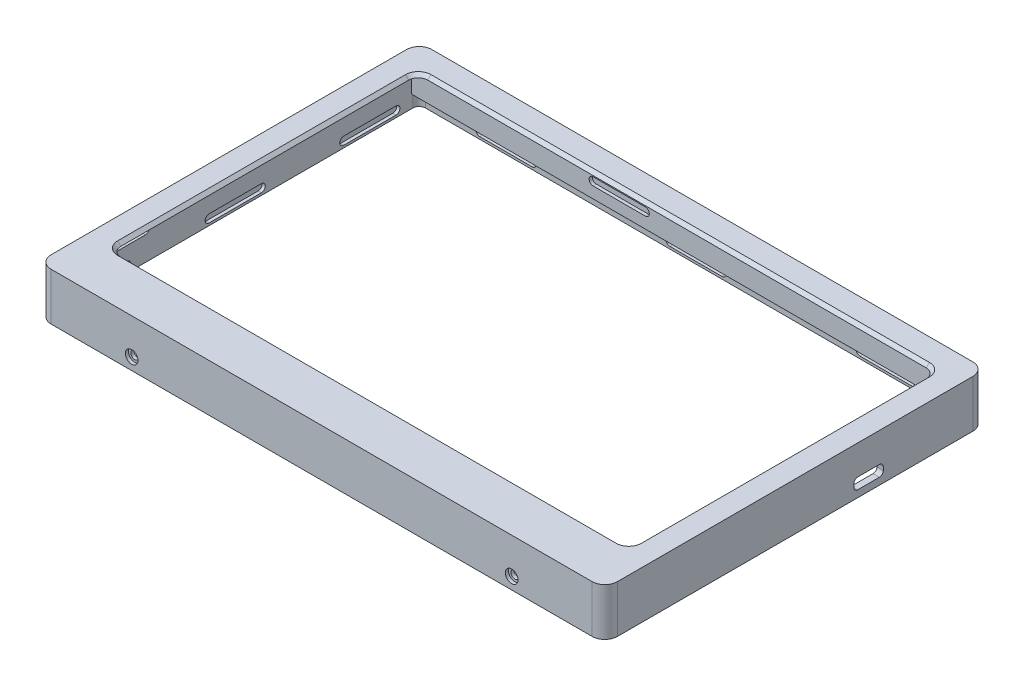
from build123d import *

# Parameters (mm, degrees)
SKETCH_1_W           = 178.8
SKETCH_1_H           = 120.2
EXTRUDE_1_DEPTH      = 16
SHELL_1_T            = -2
SKETCH_4_W           = 178.821358432
SKETCH_4_H           = 120.2
CUT_EXTRUDE_2_DEPTH  = 1
SKETCH_2_W           = 163.4
SKETCH_2_H           = 96.92
CUT_EXTRUDE_1_DEPTH  = 1
FILLET_2_R           = 3
CHAMFER_1_SIZE       = 1
EXTRUDE_2_DEPTH      = 1
SKETCH1_W            = 178.8
SKETCH1_H            = 11
BOSS_EXTRUDE1_DEPTH  = 2.395
FILLET_1_R           = 4
CUT_EXTRUDE_3_DEPTH  = 1
CUT_EXTRUDE_4_DEPTH  = 1
CUT_EXTRUDE1_DEPTH   = 1
CUT_EXTRUDE_5_DEPTH  = 1
CUT_EXTRUDE_7_REACH  = 191.226
CUT_EXTRUDE_9_DEPTH  = 1
CUT_EXTRUDE3_DEPTH   = 1
CUT_EXTRUDE_10_DEPTH = 1
CUT_EXTRUDE2_DEPTH   = 1
FILLET1_R            = 2
SKETCH4_R            = 2
SKETCH4_R_2          = 1.25
CUT_EXTRUDE4_DEPTH   = 1
SKETCH4_3_R          = 1.25
CUT_EXTRUDE5_DEPTH   = 2
CUT_EXTRUDE6_DEPTH   = 1


with BuildPart() as part:
    # 草圖1 → 填料-伸長1 (new body)
    with BuildSketch(Plane(origin=(0, 0, 0), x_dir=(1, 0, 0), z_dir=(0, 1, 0))):
        Rectangle(SKETCH_1_W, SKETCH_1_H)
    extrude(amount=EXTRUDE_1_DEPTH)

    # 薄殼1
    shell_1_openings = [part.faces().sort_by_distance(p)[0] for p in [
        (0, 0, 0),
    ]]
    offset(amount=SHELL_1_T, openings=shell_1_openings, kind=Kind.INTERSECTION)

    # 草圖4 → 除料-伸長2 (cut)
    with BuildSketch(Plane(origin=(0, 16, 0), x_dir=(1, 0, 0), z_dir=(0, 1, 0))):
        Rectangle(SKETCH_4_W, SKETCH_4_H)
    extrude(amount=-CUT_EXTRUDE_2_DEPTH, mode=Mode.SUBTRACT)

    # 草圖2 → 除料-伸長1 (cut)
    with BuildSketch(Plane(origin=(0, 15, 0), x_dir=(1, 0, 0), z_dir=(0, 1, 0))):
        with Locations((0, 3.64)):
            Rectangle(SKETCH_2_W, SKETCH_2_H)
    extrude(amount=-CUT_EXTRUDE_1_DEPTH, mode=Mode.SUBTRACT)

    # 圓角2
    fillet_2_edges = [part.edges().sort_by_distance(p)[0] for p in [
        (81.7, 14.5, -52.1),
        (81.7, 14.5, 44.82),
        (-81.7, 14.5, 44.82),
        (-81.7, 14.5, -52.1),
    ]]
    fillet(fillet_2_edges, radius=FILLET_2_R)

    # 導角1
    chamfer_1_edges = [part.edges().sort_by_distance(p)[0] for p in [
        (0, 15, 44.82),
        (80.821320344, 15, 43.941320344),
        (-80.821320344, 15, 43.941320344),
        (81.7, 15, -3.64),
        (-81.7, 15, -3.64),
        (80.821320344, 15, -51.221320344),
        (-80.821320344, 15, -51.221320344),
        (0, 15, -52.1),
    ]]
    chamfer(chamfer_1_edges, length=CHAMFER_1_SIZE - 0.0001)  # a hair under: the kernel refuses the full size

    # 草圖13 → 填料-伸長2 (add)
    with BuildSketch(Plane.XZ.offset(-14)):
        Polygon((-87.4, 58.1), (-15, 58.1), (-15, 55.965), (-85.325, 55.965), (-85.325, -55.705), (85.325, -55.705), (85.325, 55.965), (15, 55.965), (15, 58.1), (87.4, 58.1), (87.4, -58.1), (-87.4, -58.1), align=None)
    extrude(amount=EXTRUDE_2_DEPTH)

    # Sketch1 → Boss-Extrude1 (add)
    with BuildSketch(Plane.XY.offset(-58.1)):
        with Locations((0, 9.5)):
            Rectangle(SKETCH1_W, SKETCH1_H)
    extrude(amount=BOSS_EXTRUDE1_DEPTH)

    # 圓角1
    fillet_1_edges = [part.edges().sort_by_distance(p)[0] for p in [
        (89.4, 7.5, 60.1),
        (-89.4, 7.5, 60.1),
        (-89.4, 7.5, -60.1),
        (89.4, 7.5, -60.1),
    ]]
    fillet(fillet_1_edges, radius=FILLET_1_R)

    # 草圖5 → 除料-伸長3 (cut)
    with BuildSketch(Plane.XY.offset(-55.705)):
        with BuildLine():
            Line((-30.1, 7.56), (-13.6, 7.56))
            ThreePointArc((-13.6, 7.56), (-12.35, 8.81), (-13.6, 10.06))
            Line((-13.6, 10.06), (-30.1, 10.06))
            ThreePointArc((-30.1, 10.06), (-31.35, 8.81), (-30.1, 7.56))
        make_face()
    extrude(amount=-CUT_EXTRUDE_3_DEPTH, mode=Mode.SUBTRACT)

    # 草圖6 → 除料-伸長4 (cut)
    with BuildSketch(Plane(origin=(-87.4, 0, 0), x_dir=(0, 0, -1), z_dir=(1, 0, 0))):
        with BuildLine():
            Line((-28.39, 10.06), (-44.89, 10.06))
            ThreePointArc((-44.89, 10.06), (-46.14, 8.81), (-44.89, 7.56))
            Line((-44.89, 7.56), (-28.39, 7.56))
            ThreePointArc((-28.39, 7.56), (-27.14, 8.81), (-28.39, 10.06))
        make_face()
    cut_extrude_4 = extrude(amount=-CUT_EXTRUDE_4_DEPTH, mode=Mode.SUBTRACT)

    # Mirror4: 除料-伸長4 across plane
    add(cut_extrude_4.mirror(Plane.ZY), mode=Mode.SUBTRACT)

    # 草圖6<4> → Cut-Extrude1 (cut)
    with BuildSketch(Plane(origin=(-87.4, 0, 0), x_dir=(0, 0, -1), z_dir=(1, 0, 0))):
        with BuildLine():
            ThreePointArc((44.89, 13), (46.14, 11.75), (44.89, 10.5))
            Line((44.89, 10.5), (28.39, 10.5))
            ThreePointArc((28.39, 10.5), (27.14, 11.75), (28.39, 13))
            Line((28.39, 13), (44.89, 13))
        make_face()
    cut_extrude1 = extrude(amount=-CUT_EXTRUDE1_DEPTH, mode=Mode.SUBTRACT)

    # Mirror2: Cut-Extrude1 across plane
    add(cut_extrude1.mirror(Plane.ZY), mode=Mode.SUBTRACT)

    # 草圖7 → 除料-伸長5 (cut)
    with BuildSketch(Plane(origin=(0, 0, 58.1), x_dir=(-1, 0, 0), z_dir=(0, 0, -1))):
        with BuildLine():
            Line((-55.28, 7.56), (-38.78, 7.56))
            ThreePointArc((-38.78, 7.56), (-37.53, 8.81), (-38.78, 10.06))
            Line((-38.78, 10.06), (-55.28, 10.06))
            ThreePointArc((-55.28, 10.06), (-56.53, 8.81), (-55.28, 7.56))
        make_face()
        with BuildLine():
            ThreePointArc((38.78, 7.56), (37.53, 8.81), (38.78, 10.06))
            Line((38.78, 10.06), (55.28, 10.06))
            ThreePointArc((55.28, 10.06), (56.53, 8.81), (55.28, 7.56))
            Line((55.28, 7.56), (38.78, 7.56))
        make_face()
    extrude(amount=-CUT_EXTRUDE_5_DEPTH, mode=Mode.SUBTRACT)

    # 草圖9 → 除料-伸長7 (cut, up to next)
    with BuildSketch(Plane(origin=(89.4, 0, 0), x_dir=(0, 0, -1), z_dir=(1, 0, 0)), mode=Mode.PRIVATE) as cut_extrude_7_sk1:
        with BuildLine():
            Line((26.59, 2.18), (19.79, 2.18))
            ThreePointArc((19.79, 2.18), (18.906116524, 2.546116524), (18.54, 3.43))
            Line((18.54, 3.43), (18.54, 4.43))
            ThreePointArc((18.54, 4.43), (18.906116524, 5.313883476), (19.79, 5.68))
            Line((19.79, 5.68), (26.59, 5.68))
            ThreePointArc((26.59, 5.68), (27.473883476, 5.313883476), (27.84, 4.43))
            Line((27.84, 4.43), (27.84, 3.43))
            ThreePointArc((27.84, 3.43), (27.473883476, 2.546116524), (26.59, 2.18))
        make_face()
    cut_extrude_7_tool1 = extrude(cut_extrude_7_sk1.sketch, amount=-CUT_EXTRUDE_7_REACH, mode=Mode.PRIVATE) & part.part
    add(cut_extrude_7_tool1.solids().sort_by_distance((89.4, 3.93, -23.19))[0], mode=Mode.SUBTRACT)

    # 草圖11 → 除料-伸長9 (cut)
    with BuildSketch(Plane.XY.offset(-58.1)):
        with BuildLine():
            Line((-8.25, 0.75), (8.25, 0.75))
            ThreePointArc((8.25, 0.75), (9.5, 2), (8.25, 3.25))
            Line((8.25, 3.25), (-8.25, 3.25))
            ThreePointArc((-8.25, 3.25), (-9.5, 2), (-8.25, 0.75))
        make_face()
    extrude(amount=-CUT_EXTRUDE_9_DEPTH, mode=Mode.SUBTRACT)

    # 草圖11<3> → Cut-Extrude3 (cut)
    with BuildSketch(Plane.XY.offset(-58.1)):
        with BuildLine():
            Line((51.75, 0.75), (68.25, 0.75))
            ThreePointArc((68.25, 0.75), (69.5, 2), (68.25, 3.25))
            Line((68.25, 3.25), (51.75, 3.25))
            ThreePointArc((51.75, 3.25), (50.5, 2), (51.75, 0.75))
        make_face()
        with BuildLine():
            Line((-68.25, 0.75), (-51.75, 0.75))
            ThreePointArc((-51.75, 0.75), (-50.5, 2), (-51.75, 3.25))
            Line((-51.75, 3.25), (-68.25, 3.25))
            ThreePointArc((-68.25, 3.25), (-69.5, 2), (-68.25, 0.75))
        make_face()
    extrude(amount=-CUT_EXTRUDE3_DEPTH, mode=Mode.SUBTRACT)

    # 草圖12 → 除料-伸長10 (cut)
    with BuildSketch(Plane(origin=(-87.4, 0, 0), x_dir=(0, 0, -1), z_dir=(1, 0, 0))):
        with BuildLine():
            Line((-8.25, 3.25), (8.25, 3.25))
            ThreePointArc((8.25, 3.25), (9.5, 2), (8.25, 0.75))
            Line((8.25, 0.75), (-8.25, 0.75))
            ThreePointArc((-8.25, 0.75), (-9.5, 2), (-8.25, 3.25))
        make_face()
        with BuildLine():
            Line((34.25, 3.25), (50.75, 3.25))
            ThreePointArc((50.75, 3.25), (52, 2), (50.75, 0.75))
            Line((50.75, 0.75), (34.25, 0.75))
            ThreePointArc((34.25, 0.75), (33, 2), (34.25, 3.25))
        make_face()
        with BuildLine():
            Line((-50.75, 3.25), (-34.25, 3.25))
            ThreePointArc((-34.25, 3.25), (-33, 2), (-34.25, 0.75))
            Line((-34.25, 0.75), (-50.75, 0.75))
            ThreePointArc((-50.75, 0.75), (-52, 2), (-50.75, 3.25))
        make_face()
    cut_extrude_10 = extrude(amount=-CUT_EXTRUDE_10_DEPTH, mode=Mode.SUBTRACT)

    # 鏡射2: 除料-伸長10 across plane
    add(cut_extrude_10.mirror(Plane.ZY), mode=Mode.SUBTRACT)

    # Sketch3 → Cut-Extrude2 (cut)
    with BuildSketch(Plane.XY.offset(-55.705)):
        with BuildLine():
            Line((51.900266162, 13), (68.400266162, 13))
            ThreePointArc((68.400266162, 13), (69.650266162, 11.75), (68.400266162, 10.5))
            Line((68.400266162, 10.5), (51.900266162, 10.5))
            ThreePointArc((51.900266162, 10.5), (50.650266162, 11.75), (51.900266162, 13))
        make_face()
    extrude(amount=-CUT_EXTRUDE2_DEPTH, mode=Mode.SUBTRACT)

    # Fillet1
    fillet1_edges = [part.edges().sort_by_distance(p)[0] for p in [
        (-87.4, 6.5, 58.1),
        (87.4, 6.5, 58.1),
        (-87.4, 2, -58.1),
        (87.4, 2, -58.1),
    ]]
    fillet(fillet1_edges, radius=FILLET1_R)

    # Sketch4 → Cut-Extrude4 (cut)
    # profile 1 of 2: a face of its own
    with BuildSketch(Plane.XY.offset(60.1)):
        with Locations((60, 3.75)):
            Circle(SKETCH4_R)
        with Locations((60, 3.75)):
            Circle(SKETCH4_R_2, mode=Mode.SUBTRACT)
    # profile 2 of 2: a face of its own
    with BuildSketch(Plane.XY.offset(60.1)):
        with Locations((60, 3.75)):
            Circle(SKETCH4_R_2)
    cut_extrude4 = extrude(amount=-CUT_EXTRUDE4_DEPTH, mode=Mode.SUBTRACT)

    # Sketch4<3> → Cut-Extrude5 (cut)
    with BuildSketch(Plane.XY.offset(60.1)):
        with Locations((60, 3.75)):
            Circle(SKETCH4_3_R)
    cut_extrude5 = extrude(amount=-CUT_EXTRUDE5_DEPTH, mode=Mode.SUBTRACT)

    # Mirror3: Cut-Extrude4, Cut-Extrude5 across plane
    add(cut_extrude4.mirror(Plane.ZY), mode=Mode.SUBTRACT)
    add(cut_extrude5.mirror(Plane.ZY), mode=Mode.SUBTRACT)

    # Sketch5 → Cut-Extrude6 (cut)
    with BuildSketch(Plane(origin=(0, 0, 58.1), x_dir=(-1, 0, 0), z_dir=(0, 0, -1))):
        with BuildLine():
            Line((27, 3.25), (43.5, 3.25))
            ThreePointArc((43.5, 3.25), (44.75, 2), (43.5, 0.75))
            Line((43.5, 0.75), (27, 0.75))
            ThreePointArc((27, 0.75), (25.75, 2), (27, 3.25))
        make_face()
        with BuildLine():
            Line((-27, 3.25), (-43.5, 3.25))
            ThreePointArc((-43.5, 3.25), (-44.75, 2), (-43.5, 0.75))
            Line((-43.5, 0.75), (-27, 0.75))
            ThreePointArc((-27, 0.75), (-25.75, 2), (-27, 3.25))
        make_face()
    extrude(amount=-CUT_EXTRUDE6_DEPTH, mode=Mode.SUBTRACT)


solid = part.part
